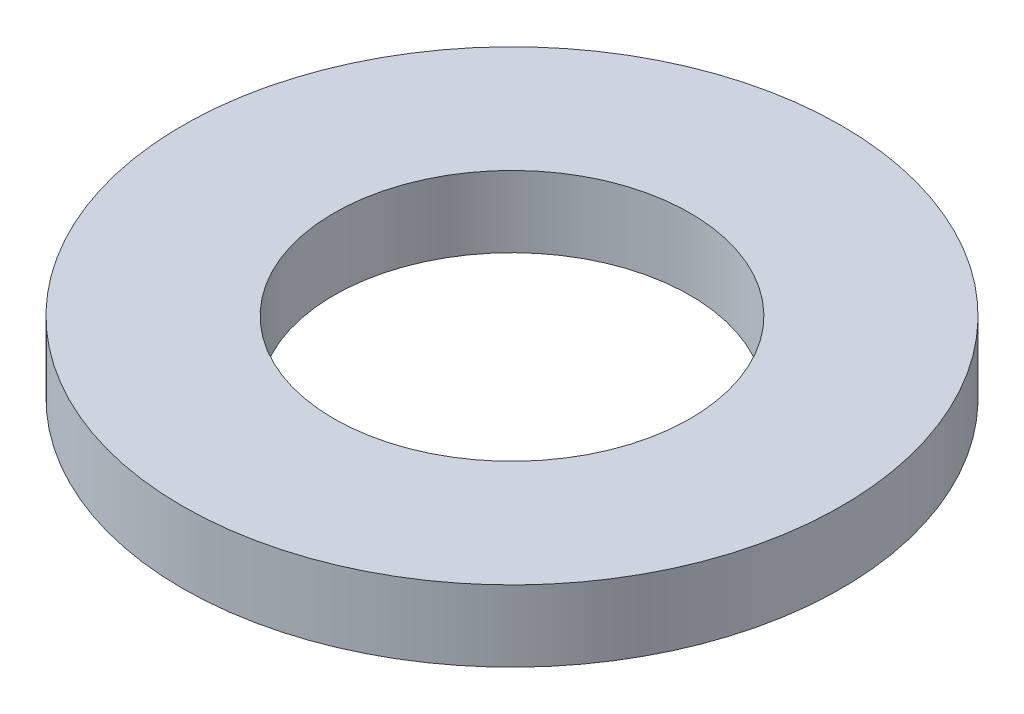
from build123d import *

# Parameters (mm, degrees)
SKETCH1_R           = 92.5
BOSS_EXTRUDE1_DEPTH = 20
SKETCH2_R           = 50
CUT_EXTRUDE1_DEPTH  = 133.334802679


with BuildPart() as part:
    # Sketch1 → Boss-Extrude1 (new body)
    with BuildSketch(Plane(origin=(0, 0, 0), x_dir=(1, 0, 0), z_dir=(0, 1, 0))):
        Circle(SKETCH1_R)
    extrude(amount=BOSS_EXTRUDE1_DEPTH)

    # Sketch2 → Cut-Extrude1 (cut, through all)
    with BuildSketch(Plane(origin=(0, 0, 0), x_dir=(1, 0, 0), z_dir=(0, 1, 0))):
        Circle(SKETCH2_R)
    extrude(amount=CUT_EXTRUDE1_DEPTH, mode=Mode.SUBTRACT)


solid = part.part
